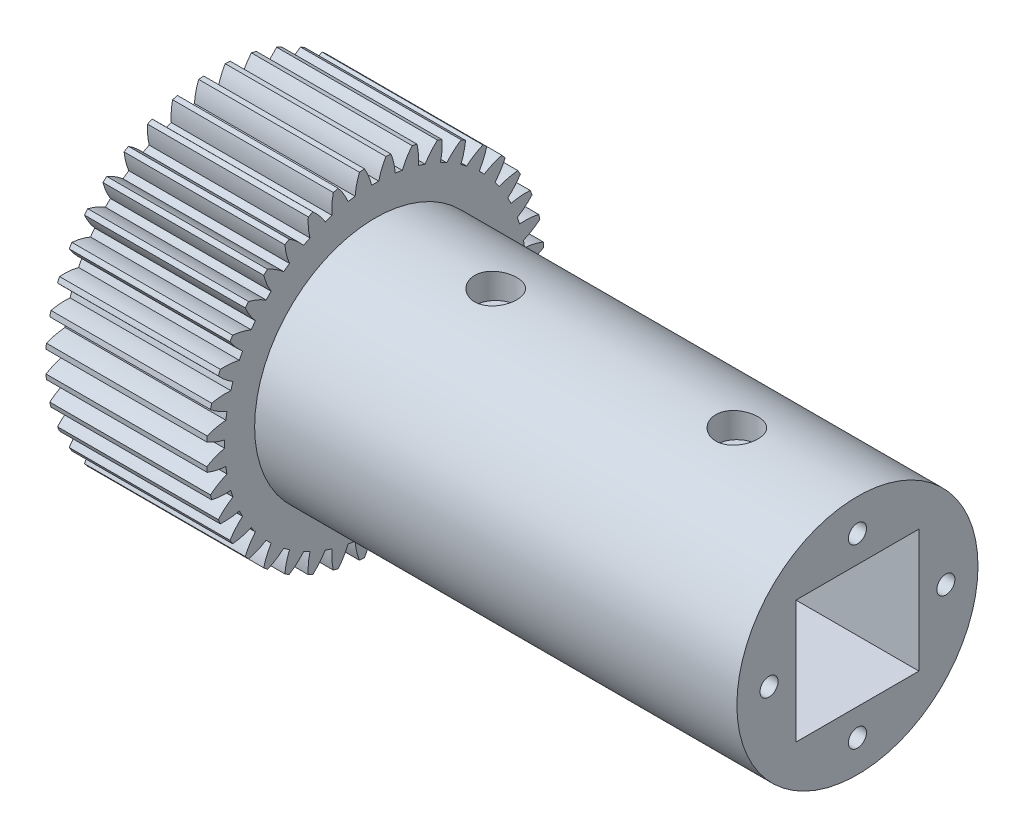
from build123d import *

# Parameters (mm, degrees)
BASPROSKE_W             = 40
BASPROSKE_H             = 42
TOOTHCUT_DEPTH          = 72.61005516
TEETHCUTS_COUNT         = 40
TEETHCUTS_ANGLE         = 351
BORSKE_R                = 0.4
BORE_DEPTH              = 50.0000508
SKETCH1_W               = 30.6
SKETCH1_H               = 30.6
CUT_EXTRUDE1_DEPTH      = 72.510885263
SKETCH2_R               = 30
SKETCH2_W               = 30.6
SKETCH2_H               = 30.6
BOSS_EXTRUDE1_DEPTH     = 120
SKETCH3_R               = 2.25
CUT_EXTRUDE2_DEPTH      = 10
CUT_EXTRUDE3_DEPTH      = 171.62768448
CUT_EXTRUDE3_DEPTH_BACK = 171.62768448
SKETCH4_R               = 3.2
CUT_EXTRUDE4_DEPTH      = 10
SKETCH7_R               = 5.25
CUT_EXTRUDE5_DEPTH      = 6.5


with BuildPart() as part:
    # BasProSke → Base-Revolve (revolve)
    with BuildSketch(Plane(origin=(0, 0, 0), x_dir=(1, 0, 0), z_dir=(0, 1, 0))):
        with Locations((20, 21)):
            Rectangle(BASPROSKE_W, BASPROSKE_H)
    revolve(axis=Axis((-10, 0, 0), (1, 0, 0)))

    # TooCutSke → ToothCut (cut, through all)
    with BuildSketch(Plane(origin=(0, 0, 0), x_dir=(0, 0, -1), z_dir=(1, 0, 0))):
        with BuildLine():
            ThreePointArc((0.882812088, 37.488606854), (0, 37.499), (-0.882812088, 37.488606854))
            ThreePointArc((-0.882812088, 37.488606854), (-1.612748684, 39.782000434), (-2.678427154, 41.939960338))
            ThreePointArc((-2.678427154, 41.939960338), (0, 42.0254), (2.678427154, 41.939960338))
            ThreePointArc((2.678427154, 41.939960338), (1.612748684, 39.782000434), (0.882812088, 37.488606854))
        make_face()
    toothcut = extrude(amount=TOOTHCUT_DEPTH, mode=Mode.SUBTRACT)

    # TeethCuts: ToothCut ×40 about axis
    teethcuts_axis = Axis((-10, 0, 0), (1, 0, 0))
    for i in range(1, TEETHCUTS_COUNT):
        add(toothcut.rotate(teethcuts_axis, i * TEETHCUTS_ANGLE / (TEETHCUTS_COUNT - 1)), mode=Mode.SUBTRACT)

    # BorSke → Bore (cut, symmetric)
    with BuildSketch(Plane(origin=(0, 0, 0), x_dir=(0, 0, -1), z_dir=(1, 0, 0))):
        Circle(BORSKE_R)
    extrude(amount=BORE_DEPTH, both=True, mode=Mode.SUBTRACT)

    # Sketch1 → Cut-Extrude1 (cut, through all)
    with BuildSketch(Plane(origin=(40, 0, 0), x_dir=(0, 0, -1), z_dir=(1, 0, 0))):
        Rectangle(SKETCH1_W, SKETCH1_H)
    extrude(amount=-CUT_EXTRUDE1_DEPTH, mode=Mode.SUBTRACT)

    # Sketch2 → Boss-Extrude1 (add)
    with BuildSketch(Plane(origin=(40, 0, 0), x_dir=(0, 0, -1), z_dir=(1, 0, 0))):
        Circle(SKETCH2_R)
        Rectangle(SKETCH2_W, SKETCH2_H, mode=Mode.SUBTRACT)
    extrude(amount=BOSS_EXTRUDE1_DEPTH)

    # Sketch3 → Cut-Extrude2 (cut)
    with BuildSketch(Plane(origin=(160, 0, 0), x_dir=(0, 0, -1), z_dir=(1, 0, 0))):
        with Locations((22, 0)):
            Circle(SKETCH3_R)
        with Locations((0, -22)):
            Circle(SKETCH3_R)
        with Locations((-22, 0)):
            Circle(SKETCH3_R)
        with Locations((0, 22)):
            Circle(SKETCH3_R)
    extrude(amount=-CUT_EXTRUDE2_DEPTH, mode=Mode.SUBTRACT)

    # Sketch4 → Cut-Extrude3 (cut, two sides: drawn at the far end of the back side and taken through both)
    with BuildSketch(Plane(origin=(0, 0, 0), x_dir=(1, 0, 0), z_dir=(0, 1, 0)).offset(-CUT_EXTRUDE3_DEPTH_BACK)):
        with Locations((70, 0)):
            Circle(SKETCH4_R)
        with Locations((130, 0)):
            Circle(SKETCH4_R)
    extrude(amount=CUT_EXTRUDE3_DEPTH + CUT_EXTRUDE3_DEPTH_BACK, mode=Mode.SUBTRACT)

    # Sketch6 → Cut-Extrude4 (cut)
    with BuildSketch(Plane(origin=(0, -30, 0), x_dir=(-1, 0, 0), z_dir=(0, -1, 0))):
        Polygon((-123.9955572, 0), (-126.9977786, 5.2), (-133.0022214, 5.2), (-136.0044428, 0), (-133.0022214, -5.2), (-126.9977786, -5.2), align=None)
        Polygon((-76.0044428, 0), (-73.0022214, -5.2), (-66.9977786, -5.2), (-63.9955572, 0), (-66.9977786, 5.2), (-73.0022214, 5.2), align=None)
    extrude(amount=-CUT_EXTRUDE4_DEPTH, mode=Mode.SUBTRACT)

    # Sketch7 → Cut-Extrude5 (cut)
    with BuildSketch(Plane(origin=(0, 30, 0), x_dir=(1, 0, 0), z_dir=(0, 1, 0))):
        with Locations((70, 0)):
            Circle(SKETCH7_R)
        with Locations((130, 0)):
            Circle(SKETCH7_R)
    extrude(amount=-CUT_EXTRUDE5_DEPTH, mode=Mode.SUBTRACT)


solid = part.part
